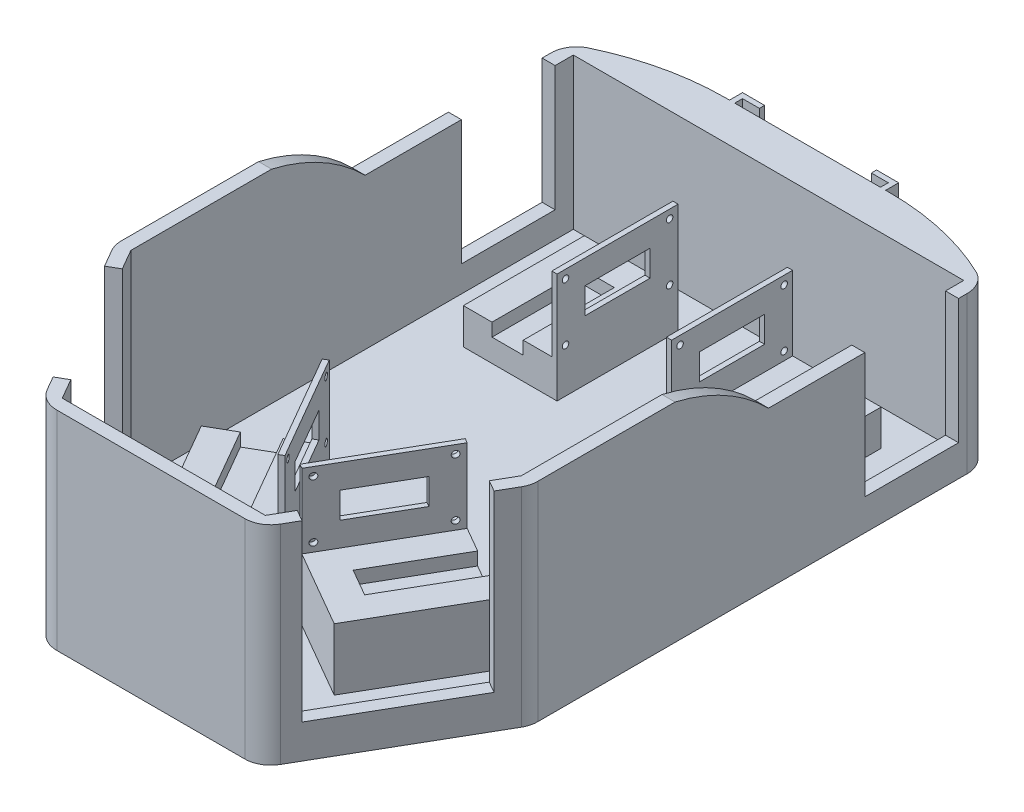
from build123d import *

# Parameters (mm, degrees)
BOSS_EXTRUDE1_DEPTH  = 80
BOSS_EXTRUDE2_DEPTH  = 2
SKETCH9_W            = 34
SKETCH9_H            = 46.5
BOSS_EXTRUDE3_DEPTH  = 13.75
SKETCH13_W           = 46.5
SKETCH13_H           = 42.25
BOSS_EXTRUDE7_DEPTH  = 2
SKETCH14_R           = 1.25
SKETCH14_W           = 25
SKETCH14_H           = 10
CUT_EXTRUDE1_DEPTH   = 2
SKETCH15_W           = 12
SKETCH15_H           = 35
CUT_EXTRUDE2_DEPTH   = 5
CUT_EXTRUDE3_DEPTH   = 298.215141228
FILLET5_R            = 10
SKETCH16_W           = 36
SKETCH16_H           = 48
CUT_EXTRUDE4_DEPTH   = 5
BOSS_EXTRUDE16_DEPTH = 23.75
SKETCH39_W           = 46.5
SKETCH39_H           = 52.25
BOSS_EXTRUDE17_DEPTH = 2
SKETCH40_R           = 1.25
SKETCH40_W           = 25
SKETCH40_H           = 10
CUT_EXTRUDE10_DEPTH  = 2
CUT_EXTRUDE11_DEPTH  = 5
SKETCH43_W           = 54
SKETCH43_H           = 67
CUT_EXTRUDE12_DEPTH  = 5
SKETCH44_W           = 150
SKETCH44_H           = 10
BOSS_EXTRUDE18_DEPTH = 60
SKETCH45_W           = 60
SKETCH45_H           = 60
BOSS_EXTRUDE19_DEPTH = 5
FILLET8_R            = 10
FILLET9_R            = 100
CUT_EXTRUDE13_DEPTH  = 51
SKETCH48_W           = 56
SKETCH48_H           = 3
CUT_EXTRUDE14_DEPTH  = 7


with BuildPart() as part:
    # Sketch1 → Boss-Extrude1 (new body)
    with BuildSketch(Plane(origin=(0, 0, 0), x_dir=(1, 0, 0), z_dir=(0, 1, 0))):
        Polygon((-5, 5), (-5, -171.339745962), (33.113248654, -237.353829072), (116.886751346, -237.353829072), (155, -171.339745962), (155, 5), align=None)
        Polygon((0, 0), (0, -170), (36, -232.353829072), (114, -232.353829072), (150, -170), (150, 0), align=None, mode=Mode.SUBTRACT)
    extrude(amount=BOSS_EXTRUDE1_DEPTH)



with BuildPart() as body_2:
    # Sketch8 → Boss-Extrude2 (new body)
    with BuildSketch(Plane.XZ):
        Polygon((0, 0), (0, 170), (36, 232.353829072), (114, 232.353829072), (150, 170), (150, 0), align=None)
    extrude(amount=-BOSS_EXTRUDE2_DEPTH)


with BuildPart() as part_1:
    add(part.part)

    add(body_2.part)  # Boss-Extrude3 merges body 2
    # Sketch9 → Boss-Extrude3 (add)
    with BuildSketch(Plane(origin=(0, 2, 0), x_dir=(1, 0, 0), z_dir=(0, 1, 0))):
        with Locations((115, -37)):
            Rectangle(SKETCH9_W, SKETCH9_H)
    boss_extrude3 = extrude(amount=BOSS_EXTRUDE3_DEPTH)

    # Sketch13 → Boss-Extrude7 (add)
    with BuildSketch(Plane.ZY.offset(-98)):
        with Locations((37, 23.125)):
            Rectangle(SKETCH13_W, SKETCH13_H)
    boss_extrude7 = extrude(amount=BOSS_EXTRUDE7_DEPTH)

    # Sketch14 → Cut-Extrude1 (cut)
    with BuildSketch(Plane.ZY.offset(-96)):
        with Locations((17, 41)):
            Circle(SKETCH14_R)
        with Locations((57, 41)):
            Circle(SKETCH14_R)
        with Locations(Location((57, 19, 0), (0, 0, 180))):
            Circle(SKETCH14_R)
        with Locations(Location((17, 19, 0), (0, 0, 180))):
            Circle(SKETCH14_R)
        with Locations((37, 30)):
            Rectangle(SKETCH14_W, SKETCH14_H)
    cut_extrude1 = extrude(amount=-CUT_EXTRUDE1_DEPTH, mode=Mode.SUBTRACT)

    # Sketch15 → Cut-Extrude2 (cut)
    with BuildSketch(Plane(origin=(0, 15.75, 0), x_dir=(1, 0, 0), z_dir=(0, 1, 0))):
        with Locations((115, -42.75)):
            Rectangle(SKETCH15_W, SKETCH15_H)
    cut_extrude2 = extrude(amount=-CUT_EXTRUDE2_DEPTH, mode=Mode.SUBTRACT)

    # Sketch17 → Cut-Extrude3 (cut, through all)
    with BuildSketch(Plane(origin=(155, 0, 0), x_dir=(0, 0, -1), z_dir=(1, 0, 0))):
        with BuildLine():
            Line((5, 60), (-80, 60))
            ThreePointArc((-80, 60), (-96.561006469, 72.526691771), (-115.934560766, 80))
            Line((-115.934560766, 80), (5, 80))
            Line((5, 80), (5, 60))
        make_face()
    extrude(amount=-CUT_EXTRUDE3_DEPTH, mode=Mode.SUBTRACT)

    # Fillet5
    fillet5_edges = [part_1.edges().sort_by_distance(p)[0] for p in [
        (-5, 40, 171.339745962),
        (33.113248654, 40, 237.353829072),
        (116.886751346, 40, 237.353829072),
        (155, 40, 171.339745962),
    ]]
    fillet(fillet5_edges, radius=FILLET5_R)

    # Sketch16 → Cut-Extrude4 (cut)
    with BuildSketch(Plane.ZY.offset(-150)):
        with Locations((25, 36)):
            Rectangle(SKETCH16_W, SKETCH16_H)
    cut_extrude4 = extrude(amount=-CUT_EXTRUDE4_DEPTH, mode=Mode.SUBTRACT)

    # Sketch38 → Boss-Extrude16 (add)
    with BuildSketch(Plane(origin=(0, 2, 0), x_dir=(1, 0, 0), z_dir=(0, 1, 0))):
        Polygon((109.054491924, -200.919700329), (132.304491924, -160.649519053), (102.859628196, -143.649519053), (79.609628196, -183.919700329), align=None)
    boss_extrude16 = extrude(amount=BOSS_EXTRUDE16_DEPTH)

    # Sketch39 → Boss-Extrude17 (add)
    with BuildSketch(Plane(origin=(139.346787517, 0, 80.451905284), x_dir=(-0.4999999999999941, 0, 0.866025403784442), z_dir=(-0.8660254037844421, 0, -0.49999999999999417))):
        with Locations((96.224318643, 28.125)):
            Rectangle(SKETCH39_W, SKETCH39_H)
    boss_extrude17 = extrude(amount=BOSS_EXTRUDE17_DEPTH)

    # Sketch40 → Cut-Extrude10 (cut)
    with BuildSketch(Plane(origin=(137.61473671, 0, 79.451905284), x_dir=(-0.4999999999999936, 0, 0.8660254037844424), z_dir=(-0.8660254037844424, 0, -0.4999999999999936))):
        with Locations((76.224318643, 51)):
            Circle(SKETCH40_R)
        with Locations(Location((116.224318643, 51, 0), (0, 0, 180))):
            Circle(SKETCH40_R)
        with Locations((116.224318643, 29)):
            Circle(SKETCH40_R)
        with Locations(Location((76.224318643, 29, 0), (0, 0, 180))):
            Circle(SKETCH40_R)
        with Locations((96.224318643, 40)):
            Rectangle(SKETCH40_W, SKETCH40_H)
    cut_extrude10 = extrude(amount=-CUT_EXTRUDE10_DEPTH, mode=Mode.SUBTRACT)

    # Sketch42 → Cut-Extrude11 (cut)
    with BuildSketch(Plane(origin=(0, 25.75, 0), x_dir=(1, 0, 0), z_dir=(0, 1, 0))):
        Polygon((105.278212483, -185.460408185), (122.778212483, -155.149519053), (112.385907637, -149.149519053), (94.885907637, -179.460408185), align=None)
    cut_extrude11 = extrude(amount=-CUT_EXTRUDE11_DEPTH, mode=Mode.SUBTRACT)

    # Sketch43 → Cut-Extrude12 (cut)
    with BuildSketch(Plane(origin=(186.112159322, 0, 107.451905284), x_dir=(-0.5000000000000009, 0, 0.8660254037844383), z_dir=(-0.8660254037844382, 0, -0.5000000000000008))):
        with Locations((108.224318643, 46.5)):
            Rectangle(SKETCH43_W, SKETCH43_H)
    cut_extrude12 = extrude(amount=-CUT_EXTRUDE12_DEPTH, mode=Mode.SUBTRACT)

    # Mirror1: Boss-Extrude3, Boss-Extrude7, Cut-Extrude1, Cut-Extrude2, Cut-Extrude4, Boss-Extrude16, Boss-Extrude17, Cut-Extrude10, Cut-Extrude11, Cut-Extrude12 across plane
    add(boss_extrude3.mirror(Plane.ZY.offset(-75)))
    add(boss_extrude7.mirror(Plane.ZY.offset(-75)))
    add(cut_extrude1.mirror(Plane.ZY.offset(-75)), mode=Mode.SUBTRACT)
    add(cut_extrude2.mirror(Plane.ZY.offset(-75)), mode=Mode.SUBTRACT)
    add(cut_extrude4.mirror(Plane.ZY.offset(-75)), mode=Mode.SUBTRACT)
    add(boss_extrude16.mirror(Plane.ZY.offset(-75)))
    add(boss_extrude17.mirror(Plane.ZY.offset(-75)))
    add(cut_extrude10.mirror(Plane.ZY.offset(-75)), mode=Mode.SUBTRACT)
    add(cut_extrude11.mirror(Plane.ZY.offset(-75)), mode=Mode.SUBTRACT)
    add(cut_extrude12.mirror(Plane.ZY.offset(-75)), mode=Mode.SUBTRACT)

    # Sketch44 → Boss-Extrude18 (add)
    with BuildSketch(Plane(origin=(0, 60, 0), x_dir=(1, 0, 0), z_dir=(0, 1, 0))):
        with Locations((75, 10)):
            Rectangle(SKETCH44_W, SKETCH44_H)
    extrude(amount=-BOSS_EXTRUDE18_DEPTH)

    # Sketch45 → Boss-Extrude19 (add)
    with BuildSketch(Plane(origin=(0, 0, -15), x_dir=(-1, 0, 0), z_dir=(0, 0, -1))):
        with Locations((-75, 30)):
            Rectangle(SKETCH45_W, SKETCH45_H)
    extrude(amount=BOSS_EXTRUDE19_DEPTH)

    # Fillet8
    # the kernel refuses this fillet: 10 mm, written as the material it takes off along each edge
    with BuildSketch(Plane(origin=(155, -21.650635095, -5), x_dir=(0, 0, 1), z_dir=(0, 1, 0))) as fillet8_piece_1:
        with BuildLine():
            CenterArc((8.660254038, -10), FILLET8_R, 90, 60)
            Line((0, -5), (-0.173205081, -4.9))
            ThreePointArc((-0.173205081, -4.9), (-0.2, -2.5), (-0.2, 0))
            Line((-0.2, 0), (0, 0.2))
            Line((0, 0.2), (8.660254038, 0.2))
            Line((8.660254038, 0.2), (8.660254038, 0))
        make_face()
    extrude(amount=103.301270189, mode=Mode.SUBTRACT)
    with BuildSketch(Plane(origin=(-5, -21.650635095, -5), x_dir=(0, 0, 1), z_dir=(0, 1, 0))) as fillet8_piece_2:
        with BuildLine():
            CenterArc((8.660254038, 10), FILLET8_R, 210, 60)
            Line((0, 5), (-0.173205081, 4.9))
            ThreePointArc((-0.173205081, 4.9), (-0.2, 2.5), (-0.2, 0))
            Line((-0.2, 0), (0, -0.2))
            Line((0, -0.2), (8.660254038, -0.2))
            Line((8.660254038, -0.2), (8.660254038, 0))
        make_face()
    extrude(amount=103.301270189, mode=Mode.SUBTRACT)

    # Fillet9
    # the kernel refuses this fillet: 100 mm, written as the material it takes off along each edge
    with BuildSketch(Plane(origin=(150, 168.972473589, -15), x_dir=(-1, 0, 0), z_dir=(0, -1, 0))) as fillet9_piece_1:
        with BuildLine():
            CenterArc((43.588989435, -100), FILLET9_R, 90, 25.841932763)
            Line((0, -10), (0, 0))
            Line((0, 0), (43.588989435, 0))
        make_face()
    extrude(amount=277.944947177, mode=Mode.SUBTRACT)
    with BuildSketch(Plane(origin=(0, 168.972473589, -15), x_dir=(0, 0, 1), z_dir=(0, -1, 0))) as fillet9_piece_2:
        with BuildLine():
            CenterArc((100, -43.588989435), FILLET9_R, 154.158067237, 25.841932763)
            Line((0, -43.588989435), (0, 0))
            Line((0, 0), (10, 0))
        make_face()
    extrude(amount=277.944947177, mode=Mode.SUBTRACT)

    # Sketch46 → Cut-Extrude13 (cut)
    with BuildSketch(Plane(origin=(0, 60, 0), x_dir=(1, 0, 0), z_dir=(0, 1, 0))):
        Polygon((53.5, 20), (96.5, 20), (96.5, 18), (103, 18), (103, 15), (47, 15), (47, 18), (53.5, 18), align=None)
    extrude(amount=-CUT_EXTRUDE13_DEPTH, mode=Mode.SUBTRACT)

    # Sketch48 → Cut-Extrude14 (cut)
    with BuildSketch(Plane(origin=(0, 9, 0), x_dir=(1, 0, 0), z_dir=(0, 1, 0))):
        with Locations((75, 16.5)):
            Rectangle(SKETCH48_W, SKETCH48_H)
    extrude(amount=-CUT_EXTRUDE14_DEPTH, mode=Mode.SUBTRACT)


solid = part_1.part
